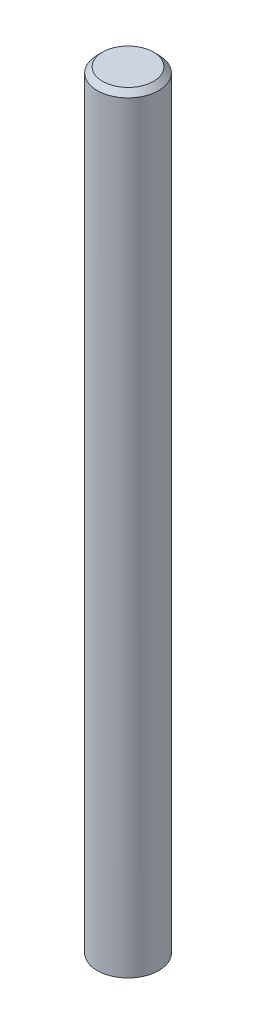
from build123d import *

# Parameters (mm, degrees)
SCHIZZO1_R                   = 4
ESTRUSIONE_ESTRUSIONE1_DEPTH = 100


# Read off the part's stored shape, not the designer's step: M8 Filettature a macchina Borchia1
with BuildPart() as part:
    # Schizzo1 → Estrusione-Estrusione1 (new body)
    with BuildSketch(Plane(origin=(0, 0, 0), x_dir=(1, 0, 0), z_dir=(0, 1, 0))):
        with Locations(Location((0, 0, 0), (0, 0, 270))):
            Circle(SCHIZZO1_R)
    extrude(amount=ESTRUSIONE_ESTRUSIONE1_DEPTH)

    # M8 Filettature a macchina Borchia1 outli → M8 Filettature a macchina Borchia1 (revolve, cut)
    with BuildSketch(Plane.XY):
        Polygon((4, 100), (3.3095, 100), (4, 99.3095), align=None)
    revolve(axis=Axis((0, 0, 0), (0, 1, 0)), mode=Mode.SUBTRACT)


solid = part.part
